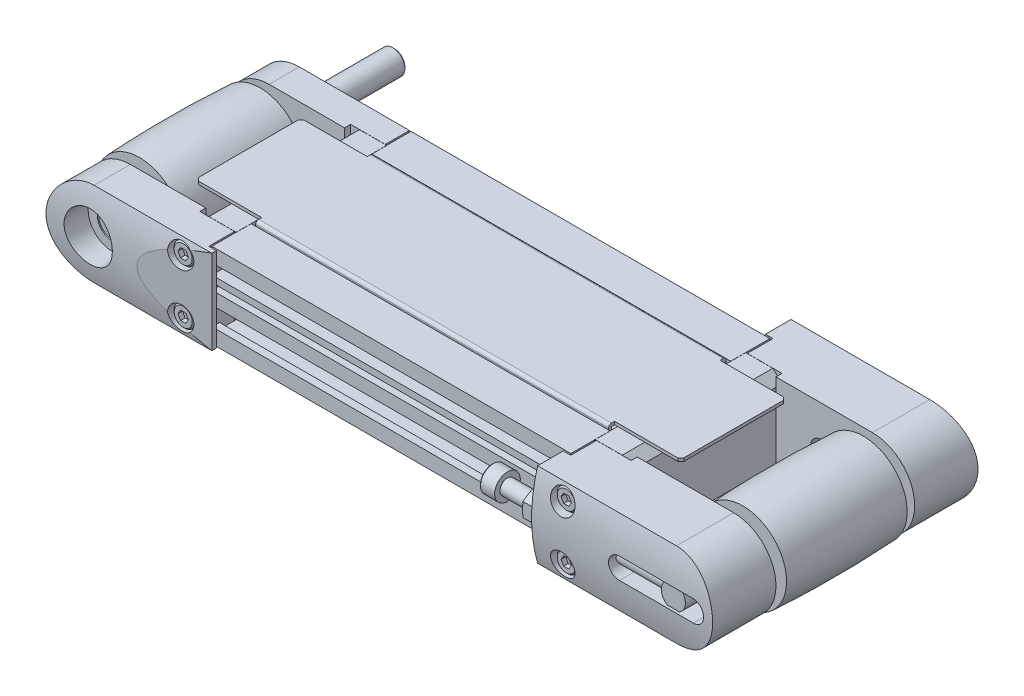
from build123d import *

# Parameters (mm, degrees)
EXTRUDE_1_DEPTH           = 14
EXTRUDE_1_DEPTH_BACK      = 14
EXTRUDE_2_DEPTH           = 14
EXTRUDE_2_DEPTH_BACK      = 14
CUT_EXTRUDE_1_DEPTH       = 10
CUT_EXTRUDE_START         = -14
CUT_EXTRUDE_2_DEPTH       = 14
CUT_EXTRUDE_3_DEPTH       = 55
EXTRUDE_3_DEPTH           = 25
EXTRUDE_3_DEPTH_BACK      = 25
EXTRUDE_4_DEPTH           = 1
EXTRUDE_4_DEPTH_BACK      = 1
SKETCH_10_W               = 3
SKETCH_10_H               = 28
SKETCH_11_W               = 0.05
SKETCH_11_H               = 0.05
CUT_EXTRUDE_4_DEPTH       = 9
SKETCH_12_W               = 0.05
SKETCH_12_H               = 0.05
CUT_EXTRUDE_5_DEPTH       = 9
SKETCH_13_W               = 0.05
SKETCH_13_H               = 0.05
CUT_EXTRUDE_6_DEPTH       = 9
SKETCH_14_W               = 0.05
SKETCH_14_H               = 0.05
CUT_EXTRUDE_7_DEPTH       = 9
SKETCH_15_R               = 2.5
EXTRUDE_5_DEPTH           = 119
SKETCH_16_R               = 2.5
EXTRUDE_6_DEPTH           = 119
SKETCH_17_W               = 5
SKETCH_17_H               = 0.05
CUT_EXTRUDE_8_DEPTH       = 0.05
SKETCH_18_W               = 5
SKETCH_18_H               = 0.05
CUT_EXTRUDE_9_DEPTH       = 0.05
SKETCH_19_W               = 5
SKETCH_19_H               = 0.05
CUT_EXTRUDE_10_DEPTH      = 0.05
SKETCH_20_W               = 5
SKETCH_20_H               = 0.05
CUT_EXTRUDE_11_DEPTH      = 0.05
SKETCH_21_W               = 6
SKETCH_21_H               = 4
SKETCH_22_W               = 6
SKETCH_22_H               = 4
CUT_EXTRUDE_12_DEPTH      = 1.5
CUT_EXTRUDE_13_DEPTH      = 1.5
EXTRUDE_7_DEPTH           = 1
EXTRUDE_7_DEPTH_BACK      = 1
SKETCH_27_W               = 3
SKETCH_27_H               = 28
EXTRUDE_8_DEPTH           = 25
EXTRUDE_8_DEPTH_BACK      = 25
SKETCH_29_W               = 5.05
SKETCH_29_H               = 0.05
CUT_EXTRUDE_14_DEPTH      = 0.05
SKETCH_30_W               = 5.05
SKETCH_30_H               = 0.05
CUT_EXTRUDE_15_DEPTH      = 0.05
SKETCH_31_W               = 5.05
SKETCH_31_H               = 0.05
CUT_EXTRUDE_16_DEPTH      = 0.05
SKETCH_32_W               = 5.05
SKETCH_32_H               = 0.05
CUT_EXTRUDE_17_DEPTH      = 0.05
EXTRUDE_9_DEPTH           = 14
EXTRUDE_9_DEPTH_BACK      = 14
SKETCH_34_W               = 0.05
SKETCH_34_H               = 0.05
CUT_EXTRUDE_18_DEPTH      = 9
SKETCH_35_W               = 0.05
SKETCH_35_H               = 0.05
CUT_EXTRUDE_19_DEPTH      = 9
EXTRUDE_10_DEPTH          = 14
EXTRUDE_10_DEPTH_BACK     = 14
SKETCH_37_W               = 0.05
SKETCH_37_H               = 0.05
CUT_EXTRUDE_20_DEPTH      = 9
SKETCH_38_W               = 0.05
SKETCH_38_H               = 0.05
CUT_EXTRUDE_21_DEPTH      = 9
CUT_EXTRUDE_22_DEPTH      = 118
CUT_EXTRUDE_23_DEPTH      = 60
CUT_EXTRUDE_24_DEPTH      = 60
SKETCH_42_W               = 5
SKETCH_42_H               = 4
SKETCH_43_W               = 5
SKETCH_43_H               = 4
CUT_EXTRUDE_25_DEPTH      = 1.5
CUT_EXTRUDE_26_DEPTH      = 1.5
SKETCH_48_W               = 5
SKETCH_48_H               = 4
SKETCH_49_W               = 5
SKETCH_49_H               = 4
CUT_EXTRUDE_27_DEPTH      = 1.5
CUT_EXTRUDE_28_DEPTH      = 1.5
EXTRUDE_11_DEPTH          = 117
EXTRUDE_12_DEPTH          = 1
EXTRUDE_13_DEPTH          = 1
CUT_EXTRUDE_29_DEPTH      = 59
CUT_EXTRUDE_29_DEPTH_BACK = 59
SKETCH_60_R               = 5.5
CUT_EXTRUDE_30_DEPTH      = 4
CUT_EXTRUDE_31_DEPTH      = 1.2
SKETCH_64_R               = 5.5
CUT_EXTRUDE_32_DEPTH      = 4
CUT_EXTRUDE_33_DEPTH      = 1.2


with BuildPart() as part:
    # 草图1 → 旋转1 (revolve)
    with BuildSketch(Plane(origin=(0, 0, 0), x_dir=(1, 0, 0), z_dir=(0, 1, 0))):
        with BuildLine():
            Line((0, -10), (5.75, -10))
            Line((5.75, -10), (5.75, -13))
            Line((5.75, -13), (14.5, -13))
            ThreePointArc((14.5, -13), (15, -33), (14.5, -53))
            Line((14.5, -53), (5.75, -53))
            Line((5.75, -53), (5.75, -56))
            Line((5.75, -56), (0, -56))
            Line((0, -56), (0, -10))
        make_face()
    revolve(axis=Axis((0, 0, 56), (0, 0, -1)))

    # 草图2 → 凸台-拉伸1 (add, two sides: drawn at the far end of the back side and taken through both)
    with BuildSketch(Plane(origin=(0, 0, 0), x_dir=(1, 0, 0), z_dir=(0, 1, 0)).offset(-EXTRUDE_1_DEPTH_BACK)):
        Polygon((-14, 0), (-14, -10), (25, -10), (25, -8), (36.5, -8), (36.5, 0), align=None)
    extrude(amount=EXTRUDE_1_DEPTH + EXTRUDE_1_DEPTH_BACK)

    # 草图3 → 凸台-拉伸2 (add, two sides: drawn at the far end of the back side and taken through both)
    with BuildSketch(Plane(origin=(0, 0, 0), x_dir=(1, 0, 0), z_dir=(0, 1, 0)).offset(-EXTRUDE_2_DEPTH_BACK)):
        Polygon((-14, -56), (-14, -70), (16.139895394, -70), (39, -68), (39, -66.5), (36.5, -66.5), (36.5, -58), (25, -58), (25, -56), align=None)
    extrude(amount=EXTRUDE_2_DEPTH + EXTRUDE_2_DEPTH_BACK)

    # 草图4 → 切除-拉伸1 (cut)
    with BuildSketch(Plane.XY):
        with BuildLine():
            Line((-28, -14), (0, -14))
            ThreePointArc((0, -14), (-14, 0), (0, 14))
            Line((0, 14), (-28, 14))
            Line((-28, 14), (-28, -14))
        make_face()
    extrude(amount=CUT_EXTRUDE_1_DEPTH, mode=Mode.SUBTRACT)

    # 草图5 → 切除-拉伸2 (cut)
    with BuildSketch(Plane.XY.offset(70).offset(CUT_EXTRUDE_START)):
        with BuildLine():
            Line((-28, -14), (0, -14))
            ThreePointArc((0, -14), (-14, 0), (0, 14))
            Line((0, 14), (-28, 14))
            Line((-28, 14), (-28, -14))
        make_face()
    extrude(amount=CUT_EXTRUDE_2_DEPTH, mode=Mode.SUBTRACT)

    # 草图6 → 切除-拉伸3 (cut)
    with BuildSketch(Plane(origin=(-15, 0, 0), x_dir=(0, 0, -1), z_dir=(1, 0, 0))):
        with BuildLine():
            Line((-85, 14), (-85, -14))
            Line((-85, -14), (-68, -14))
            ThreePointArc((-68, -14), (-70, 0), (-68, 14))
            Line((-68, 14), (-85, 14))
        make_face()
    extrude(amount=CUT_EXTRUDE_3_DEPTH, mode=Mode.SUBTRACT)

    # 草图7 → 切除-旋转1 (revolve, cut)
    with BuildSketch(Plane(origin=(0, 0, 0), x_dir=(1, 0, 0), z_dir=(0, 1, 0))):
        Polygon((0, -70), (-8, -70), (-8, -62), (-5, -62), (-5, -61.5), (-4.5, -62), (0, -62), align=None)
    revolve(axis=Axis((0, 0, 62), (0, 0, 1)), mode=Mode.SUBTRACT)

    # 草图8 → 旋转2 (revolve)
    with BuildSketch(Plane(origin=(0, 0, 0), x_dir=(1, 0, 0), z_dir=(0, 1, 0))):
        Polygon((0, 0), (-4, 0), (-4, 31), (-3.5, 31.5), (0, 31.5), align=None)
    revolve(axis=Axis((0, 0, -31.5), (0, 0, 1)))

    # 草图9 → 凸台-拉伸3 (add, two sides: drawn at the far end of the back side and taken through both)
    with BuildSketch(Plane.XY.offset(33).offset(-EXTRUDE_3_DEPTH_BACK)):
        Polygon((25, -11), (28, -14), (37, -14), (37, 14), (28, 14), (25, 11), align=None)
    extrude(amount=EXTRUDE_3_DEPTH + EXTRUDE_3_DEPTH_BACK)

    # 草图10 → 凸台-拉伸4 (add, two sides: drawn at the far end of the back side and taken through both)
    with BuildSketch(Plane.XY.offset(33).offset(-EXTRUDE_4_DEPTH_BACK)):
        with Locations((38.5, 0)):
            Rectangle(SKETCH_10_W, SKETCH_10_H)
    extrude(amount=EXTRUDE_4_DEPTH + EXTRUDE_4_DEPTH_BACK)

    # 草图11 → 切除-拉伸4 (cut)
    with BuildSketch(Plane(origin=(28, 0, 0), x_dir=(0, 0, -1), z_dir=(1, 0, 0))):
        with Locations((-8.025, 13.975)):
            Rectangle(SKETCH_11_W, SKETCH_11_H)
    extrude(amount=CUT_EXTRUDE_4_DEPTH, mode=Mode.SUBTRACT)

    # 草图12 → 切除-拉伸5 (cut)
    with BuildSketch(Plane(origin=(28, 0, 0), x_dir=(0, 0, -1), z_dir=(1, 0, 0))):
        with Locations((-8.025, -13.975)):
            Rectangle(SKETCH_12_W, SKETCH_12_H)
    extrude(amount=CUT_EXTRUDE_5_DEPTH, mode=Mode.SUBTRACT)

    # 草图13 → 切除-拉伸6 (cut)
    with BuildSketch(Plane(origin=(28, 0, 0), x_dir=(0, 0, -1), z_dir=(1, 0, 0))):
        with Locations((-57.975, 13.975)):
            Rectangle(SKETCH_13_W, SKETCH_13_H)
    extrude(amount=CUT_EXTRUDE_6_DEPTH, mode=Mode.SUBTRACT)

    # 草图14 → 切除-拉伸7 (cut)
    with BuildSketch(Plane(origin=(28, 0, 0), x_dir=(0, 0, -1), z_dir=(1, 0, 0))):
        with Locations((-57.975, -13.975)):
            Rectangle(SKETCH_14_W, SKETCH_14_H)
    extrude(amount=CUT_EXTRUDE_7_DEPTH, mode=Mode.SUBTRACT)

    # 草图15 → 凸台-拉伸5 (add)
    with BuildSketch(Plane(origin=(37, 0, 0), x_dir=(0, 0, -1), z_dir=(1, 0, 0))):
        Polygon((-66, 14), (-66, 9.25), (-62, 9.25), (-62, 10.35), (-59, 10.35), (-59, 9.25), (-57.8, 9.25), (-57.8, 5.75), (-59, 5.75), (-59, 4.65), (-62, 4.65), (-62, 5.75), (-66, 5.75), (-66, 3.6), (-63, 3.6), (-63, 1.4), (-66, 1.4), (-66, -2.9), (-63.5, -2.9), (-63.5, -0.9), (-57.5, -0.9), (-57.5, -2.9), (-56, -2.9), (-56, -9.1), (-57.5, -9.1), (-57.5, -11.1), (-63.5, -11.1), (-63.5, -9.1), (-66, -9.1), (-66, -14), (-53, -14), (-53, -5), (-48.5, -5), (-48.5, -8), (-34, -8), (-34, -4), (-35.5, -4), (-35.5, -5), (-41.5, -5), (-41.5, -4), (-42.5, -4), (-42.5, 4), (-41.5, 4), (-41.5, 5), (-35.5, 5), (-35.5, 4), (-34, 4), (-34, 8), (-48.5, 8), (-48.5, 5), (-53, 5), (-53, 14), align=None)
        with Locations((-50, 0)):
            Circle(SKETCH_15_R, mode=Mode.SUBTRACT)
    extrude(amount=EXTRUDE_5_DEPTH)

    # 草图16 → 凸台-拉伸6 (add)
    with BuildSketch(Plane(origin=(37, 0, 0), x_dir=(0, 0, -1), z_dir=(1, 0, 0))):
        Polygon((-32, 8), (-32, 4), (-30.5, 4), (-30.5, 5), (-24.5, 5), (-24.5, 4), (-23.5, 4), (-23.5, -4), (-24.5, -4), (-24.5, -5), (-30.5, -5), (-30.5, -4), (-32, -4), (-32, -8), (-17.5, -8), (-17.5, -5), (-13, -5), (-13, -14), (0, -14), (0, -9.1), (-2.5, -9.1), (-2.5, -11.1), (-8.5, -11.1), (-8.5, -9.1), (-10, -9.1), (-10, -2.9), (-8.5, -2.9), (-8.5, -0.9), (-2.5, -0.9), (-2.5, -2.9), (0, -2.9), (0, 1.4), (-3, 1.4), (-3, 3.6), (0, 3.6), (0, 5.75), (-4, 5.75), (-4, 4.65), (-7, 4.65), (-7, 5.75), (-8.2, 5.75), (-8.2, 9.25), (-7, 9.25), (-7, 10.35), (-4, 10.35), (-4, 9.25), (0, 9.25), (0, 14), (-13, 14), (-13, 5), (-17.5, 5), (-17.5, 8), align=None)
        with Locations((-16, 0)):
            Circle(SKETCH_16_R, mode=Mode.SUBTRACT)
    extrude(amount=EXTRUDE_6_DEPTH)

    # 草图17 → 切除-拉伸8 (cut)
    with BuildSketch(Plane(origin=(37, 0, 0), x_dir=(0, 0, -1), z_dir=(1, 0, 0))):
        with Locations((-10.5, 13.975)):
            Rectangle(SKETCH_17_W, SKETCH_17_H)
    extrude(amount=CUT_EXTRUDE_8_DEPTH, mode=Mode.SUBTRACT)

    # 草图18 → 切除-拉伸9 (cut)
    with BuildSketch(Plane(origin=(37, 0, 0), x_dir=(0, 0, -1), z_dir=(1, 0, 0))):
        with Locations((-55.5, 13.975)):
            Rectangle(SKETCH_18_W, SKETCH_18_H)
    extrude(amount=CUT_EXTRUDE_9_DEPTH, mode=Mode.SUBTRACT)

    # 草图19 → 切除-拉伸10 (cut)
    with BuildSketch(Plane(origin=(37, 0, 0), x_dir=(0, 0, -1), z_dir=(1, 0, 0))):
        with Locations((-10.5, -13.975)):
            Rectangle(SKETCH_19_W, SKETCH_19_H)
    extrude(amount=CUT_EXTRUDE_10_DEPTH, mode=Mode.SUBTRACT)

    # 草图20 → 切除-拉伸11 (cut)
    with BuildSketch(Plane(origin=(37, 0, 0), x_dir=(0, 0, -1), z_dir=(1, 0, 0))):
        with Locations((-55.5, -13.975)):
            Rectangle(SKETCH_20_W, SKETCH_20_H)
    extrude(amount=CUT_EXTRUDE_11_DEPTH, mode=Mode.SUBTRACT)

    # 草图21 → 切除-旋转2 (revolve, cut)
    with BuildSketch(Plane(origin=(29.5, 0, 0), x_dir=(0, 0, -1), z_dir=(1, 0, 0))):
        with Locations((-67, 11)):
            Rectangle(SKETCH_21_W, SKETCH_21_H)
    revolve(axis=Axis((29.5, 9, 64), (0, 0, 1)), mode=Mode.SUBTRACT)

    # 草图22 → 切除-旋转3 (revolve, cut)
    with BuildSketch(Plane(origin=(29.5, 0, 0), x_dir=(0, 0, -1), z_dir=(1, 0, 0))):
        with Locations((-67, -7)):
            Rectangle(SKETCH_22_W, SKETCH_22_H)
    revolve(axis=Axis((29.5, -9, 64), (0, 0, 1)), mode=Mode.SUBTRACT)

    # 草图23 → 旋转3 (revolve)
    with BuildSketch(Plane(origin=(29.5, 0, 0), x_dir=(0, 0, -1), z_dir=(1, 0, 0))):
        Polygon((-68, 9), (-68, 12), (-67.5, 12.5), (-62, 12.5), (-62, 9), align=None)
    revolve(axis=Axis((29.5, 9, 62), (0, 0, 1)))

    # 草图24 → 切除-拉伸12 (cut)
    with BuildSketch(Plane.XY.offset(68)):
        Polygon((28.633974596, 7.5), (30.366025404, 7.5), (31.232050808, 9), (30.366025404, 10.5), (28.633974596, 10.5), (27.767949192, 9), align=None)
    extrude(amount=-CUT_EXTRUDE_12_DEPTH, mode=Mode.SUBTRACT)

    # 草图25 → 旋转4 (revolve)
    with BuildSketch(Plane(origin=(29.5, 0, 0), x_dir=(0, 0, -1), z_dir=(1, 0, 0))):
        Polygon((-68, -9), (-68, -6), (-67.5, -5.5), (-62, -5.5), (-62, -9), align=None)
    revolve(axis=Axis((29.5, -9, 62), (0, 0, 1)))

    # 草图26 → 切除-拉伸13 (cut)
    with BuildSketch(Plane.XY.offset(68)):
        Polygon((28.633974596, -10.5), (30.366025404, -10.5), (31.232050808, -9), (30.366025404, -7.5), (28.633974596, -7.5), (27.767949192, -9), align=None)
    extrude(amount=-CUT_EXTRUDE_13_DEPTH, mode=Mode.SUBTRACT)

    # 草图27 → 凸台-拉伸7 (add, two sides: drawn at the far end of the back side and taken through both)
    with BuildSketch(Plane.XY.offset(33).offset(-EXTRUDE_7_DEPTH_BACK)):
        with Locations((154.5, 0)):
            Rectangle(SKETCH_27_W, SKETCH_27_H)
    extrude(amount=EXTRUDE_7_DEPTH + EXTRUDE_7_DEPTH_BACK)

    # 草图28 → 凸台-拉伸8 (add, two sides: drawn at the far end of the back side and taken through both)
    with BuildSketch(Plane.XY.offset(33).offset(-EXTRUDE_8_DEPTH_BACK)):
        Polygon((156, -14), (165, -14), (168, -11), (168, 11), (165, 14), (156, 14), align=None)
    extrude(amount=EXTRUDE_8_DEPTH + EXTRUDE_8_DEPTH_BACK)

    # 草图29 → 切除-拉伸14 (cut)
    with BuildSketch(Plane(origin=(156, 0, 0), x_dir=(0, 0, -1), z_dir=(1, 0, 0))):
        with Locations((-10.525, 13.975)):
            Rectangle(SKETCH_29_W, SKETCH_29_H)
    extrude(amount=CUT_EXTRUDE_14_DEPTH, mode=Mode.SUBTRACT)

    # 草图30 → 切除-拉伸15 (cut)
    with BuildSketch(Plane(origin=(156, 0, 0), x_dir=(0, 0, -1), z_dir=(1, 0, 0))):
        with Locations((-55.475, 13.975)):
            Rectangle(SKETCH_30_W, SKETCH_30_H)
    extrude(amount=CUT_EXTRUDE_15_DEPTH, mode=Mode.SUBTRACT)

    # 草图31 → 切除-拉伸16 (cut)
    with BuildSketch(Plane(origin=(156, 0, 0), x_dir=(0, 0, -1), z_dir=(1, 0, 0))):
        with Locations((-10.525, -13.975)):
            Rectangle(SKETCH_31_W, SKETCH_31_H)
    extrude(amount=CUT_EXTRUDE_16_DEPTH, mode=Mode.SUBTRACT)

    # 草图32 → 切除-拉伸17 (cut)
    with BuildSketch(Plane(origin=(156, 0, 0), x_dir=(0, 0, -1), z_dir=(1, 0, 0))):
        with Locations((-55.475, -13.975)):
            Rectangle(SKETCH_32_W, SKETCH_32_H)
    extrude(amount=CUT_EXTRUDE_17_DEPTH, mode=Mode.SUBTRACT)

    # 草图33 → 凸台-拉伸9 (add, two sides: drawn at the far end of the back side and taken through both)
    with BuildSketch(Plane(origin=(0, 0, 0), x_dir=(1, 0, 0), z_dir=(0, 1, 0)).offset(-EXTRUDE_9_DEPTH_BACK)):
        Polygon((154, 0.5), (156.5, 0.5), (156.5, -8), (168, -8), (168, -10), (214, -10), (214, 11), (154, 11), align=None)
    extrude(amount=EXTRUDE_9_DEPTH + EXTRUDE_9_DEPTH_BACK)

    # 草图34 → 切除-拉伸18 (cut)
    with BuildSketch(Plane(origin=(156, 0, 0), x_dir=(0, 0, -1), z_dir=(1, 0, 0))):
        with Locations((-8.025, 13.975)):
            Rectangle(SKETCH_34_W, SKETCH_34_H)
    extrude(amount=CUT_EXTRUDE_18_DEPTH, mode=Mode.SUBTRACT)

    # 草图35 → 切除-拉伸19 (cut)
    with BuildSketch(Plane(origin=(156, 0, 0), x_dir=(0, 0, -1), z_dir=(1, 0, 0))):
        with Locations((-8.025, -13.975)):
            Rectangle(SKETCH_35_W, SKETCH_35_H)
    extrude(amount=CUT_EXTRUDE_19_DEPTH, mode=Mode.SUBTRACT)

    # 草图36 → 凸台-拉伸10 (add, two sides: drawn at the far end of the back side and taken through both)
    with BuildSketch(Plane(origin=(0, 0, 0), x_dir=(1, 0, 0), z_dir=(0, 1, 0)).offset(-EXTRUDE_10_DEPTH_BACK)):
        Polygon((154, -66.5), (154, -77), (214, -77), (214, -56), (168, -56), (168, -58), (156.5, -58), (156.5, -66.5), align=None)
    extrude(amount=EXTRUDE_10_DEPTH + EXTRUDE_10_DEPTH_BACK)

    # 草图37 → 切除-拉伸20 (cut)
    with BuildSketch(Plane(origin=(156, 0, 0), x_dir=(0, 0, -1), z_dir=(1, 0, 0))):
        with Locations((-57.975, 13.975)):
            Rectangle(SKETCH_37_W, SKETCH_37_H)
    extrude(amount=CUT_EXTRUDE_20_DEPTH, mode=Mode.SUBTRACT)

    # 草图38 → 切除-拉伸21 (cut)
    with BuildSketch(Plane(origin=(156, 0, 0), x_dir=(0, 0, -1), z_dir=(1, 0, 0))):
        with Locations((-57.975, -13.975)):
            Rectangle(SKETCH_38_W, SKETCH_38_H)
    extrude(amount=CUT_EXTRUDE_21_DEPTH, mode=Mode.SUBTRACT)

    # 草图39 → 切除-拉伸22 (cut)
    with BuildSketch(Plane.XY.offset(-30)):
        with BuildLine():
            Line((200, -14), (228, -14))
            Line((228, -14), (228, 14))
            Line((228, 14), (200, 14))
            ThreePointArc((200, 14), (214, 0), (200, -14))
        make_face()
    extrude(amount=CUT_EXTRUDE_22_DEPTH, mode=Mode.SUBTRACT)

    # 草图40 → 切除-拉伸23 (cut)
    with BuildSketch(Plane(origin=(214, 0, 0), x_dir=(0, 0, -1), z_dir=(1, 0, 0))):
        with BuildLine():
            Line((9, -14), (21, -14))
            Line((21, -14), (21, 14))
            Line((21, 14), (9, 14))
            ThreePointArc((9, 14), (11, 0), (9, -14))
        make_face()
    extrude(amount=-CUT_EXTRUDE_23_DEPTH, mode=Mode.SUBTRACT)

    # 草图41 → 切除-拉伸24 (cut)
    with BuildSketch(Plane(origin=(214, 0, 0), x_dir=(0, 0, -1), z_dir=(1, 0, 0))):
        with BuildLine():
            Line((-87, 14), (-87, -14))
            Line((-87, -14), (-75, -14))
            ThreePointArc((-75, -14), (-77, 0), (-75, 14))
            Line((-75, 14), (-87, 14))
        make_face()
    extrude(amount=-CUT_EXTRUDE_24_DEPTH, mode=Mode.SUBTRACT)

    # 草图42 → 切除-旋转4 (revolve, cut)
    with BuildSketch(Plane(origin=(163.5, 0, 0), x_dir=(0, 0, -1), z_dir=(1, 0, 0))):
        with Locations((8.5, 11)):
            Rectangle(SKETCH_42_W, SKETCH_42_H)
    revolve(axis=Axis((163.5, 9, -11), (0, 0, 1)), mode=Mode.SUBTRACT)

    # 草图43 → 切除-旋转5 (revolve, cut)
    with BuildSketch(Plane(origin=(163.5, 0, 0), x_dir=(0, 0, -1), z_dir=(1, 0, 0))):
        with Locations((8.5, -7)):
            Rectangle(SKETCH_43_W, SKETCH_43_H)
    revolve(axis=Axis((163.5, -9, -11), (0, 0, 1)), mode=Mode.SUBTRACT)

    # 草图44 → 旋转5 (revolve)
    with BuildSketch(Plane(origin=(163.5, 0, 0), x_dir=(0, 0, -1), z_dir=(1, 0, 0))):
        Polygon((4, 9), (4, 12.5), (8.5, 12.5), (9, 12), (9, 9), align=None)
    revolve(axis=Axis((163.5, 9, -9), (0, 0, 1)))

    # 草图45 → 旋转6 (revolve)
    with BuildSketch(Plane(origin=(163.5, 0, 0), x_dir=(0, 0, -1), z_dir=(1, 0, 0))):
        Polygon((4, -9), (4, -5.5), (8.5, -5.5), (9, -6), (9, -9), align=None)
    revolve(axis=Axis((163.5, -9, -9), (0, 0, 1)))

    # 草图46 → 切除-拉伸25 (cut)
    with BuildSketch(Plane(origin=(0, 0, -9), x_dir=(-1, 0, 0), z_dir=(0, 0, -1))):
        Polygon((-164.366025404, 7.5), (-162.633974596, 7.5), (-161.767949192, 9), (-162.633974596, 10.5), (-164.366025404, 10.5), (-165.232050808, 9), align=None)
    extrude(amount=-CUT_EXTRUDE_25_DEPTH, mode=Mode.SUBTRACT)

    # 草图47 → 切除-拉伸26 (cut)
    with BuildSketch(Plane(origin=(0, 0, -9), x_dir=(-1, 0, 0), z_dir=(0, 0, -1))):
        Polygon((-164.366025404, -10.5), (-162.633974596, -10.5), (-161.767949192, -9), (-162.633974596, -7.5), (-164.366025404, -7.5), (-165.232050808, -9), align=None)
    extrude(amount=-CUT_EXTRUDE_26_DEPTH, mode=Mode.SUBTRACT)

    # 草图48 → 切除-旋转6 (revolve, cut)
    with BuildSketch(Plane(origin=(163.5, 0, 0), x_dir=(0, 0, -1), z_dir=(1, 0, 0))):
        with Locations((-74.5, 11)):
            Rectangle(SKETCH_48_W, SKETCH_48_H)
    revolve(axis=Axis((163.5, 9, 72), (0, 0, 1)), mode=Mode.SUBTRACT)

    # 草图49 → 切除-旋转7 (revolve, cut)
    with BuildSketch(Plane(origin=(163.5, 0, 0), x_dir=(0, 0, -1), z_dir=(1, 0, 0))):
        with Locations((-74.5, -7)):
            Rectangle(SKETCH_49_W, SKETCH_49_H)
    revolve(axis=Axis((163.5, -9, 72), (0, 0, 1)), mode=Mode.SUBTRACT)

    # 草图50 → 旋转7 (revolve)
    with BuildSketch(Plane(origin=(163.5, 0, 0), x_dir=(0, 0, -1), z_dir=(1, 0, 0))):
        Polygon((-75, 9), (-75, 12), (-74.5, 12.5), (-70, 12.5), (-70, 9), align=None)
    revolve(axis=Axis((163.5, 9, 70), (0, 0, 1)))

    # 草图51 → 旋转8 (revolve)
    with BuildSketch(Plane(origin=(163.5, 0, 0), x_dir=(0, 0, -1), z_dir=(1, 0, 0))):
        Polygon((-75, -9), (-75, -6), (-74.5, -5.5), (-70, -5.5), (-70, -9), align=None)
    revolve(axis=Axis((163.5, -9, 70), (0, 0, 1)))

    # 草图52 → 切除-拉伸27 (cut)
    with BuildSketch(Plane.XY.offset(75)):
        Polygon((162.633974596, 7.5), (164.366025404, 7.5), (165.232050808, 9), (164.366025404, 10.5), (162.633974596, 10.5), (161.767949192, 9), align=None)
    extrude(amount=-CUT_EXTRUDE_27_DEPTH, mode=Mode.SUBTRACT)

    # 草图53 → 切除-拉伸28 (cut)
    with BuildSketch(Plane.XY.offset(75)):
        Polygon((162.633974596, -10.5), (164.366025404, -10.5), (165.232050808, -9), (164.366025404, -7.5), (162.633974596, -7.5), (161.767949192, -9), align=None)
    extrude(amount=-CUT_EXTRUDE_28_DEPTH, mode=Mode.SUBTRACT)

    # 草图54 → 凸台-拉伸11 (add)
    with BuildSketch(Plane(origin=(38, 0, 0), x_dir=(0, 0, -1), z_dir=(1, 0, 0))):
        with BuildLine():
            Line((-52.5, 5), (-51.5, 5))
            Line((-51.5, 5), (-51.5, 14))
            Line((-51.5, 14), (-14.5, 14))
            Line((-14.5, 14), (-14.5, 5))
            Line((-14.5, 5), (-13.5, 5))
            Line((-13.5, 5), (-13.5, 14))
            ThreePointArc((-13.5, 14), (-13.792893219, 14.707106781), (-14.5, 15))
            Line((-14.5, 15), (-51.5, 15))
            ThreePointArc((-51.5, 15), (-52.207106781, 14.707106781), (-52.5, 14))
            Line((-52.5, 14), (-52.5, 5))
        make_face()
    extrude(amount=EXTRUDE_11_DEPTH)

    # 草图55 → 凸台-拉伸12 (add)
    with BuildSketch(Plane(origin=(0, 14, 0), x_dir=(1, 0, 0), z_dir=(0, 1, 0))):
        Polygon((16.038, -49.5), (17.038, -50.5), (38, -50.5), (38, -15.5), (17.038, -15.5), (16.038, -16.5), align=None)
    extrude(amount=EXTRUDE_12_DEPTH)

    # 草图56 → 凸台-拉伸13 (add)
    with BuildSketch(Plane(origin=(0, 14, 0), x_dir=(1, 0, 0), z_dir=(0, 1, 0))):
        Polygon((155, -50.5), (175.962, -50.5), (176.962, -49.5), (176.962, -16.5), (175.962, -15.5), (155, -15.5), align=None)
    extrude(amount=EXTRUDE_13_DEPTH)

    # 草图57 → 切除-拉伸29 (cut, two sides: drawn at the far end of the back side and taken through both)
    with BuildSketch(Plane.XY.offset(33).offset(-CUT_EXTRUDE_29_DEPTH_BACK)):
        with BuildLine():
            Line((183, -3.5), (207.5, -3.5))
            ThreePointArc((207.5, -3.5), (211, 0), (207.5, 3.5))
            Line((207.5, 3.5), (183, 3.5))
            ThreePointArc((183, 3.5), (179.5, 0), (183, -3.5))
        make_face()
    extrude(amount=CUT_EXTRUDE_29_DEPTH + CUT_EXTRUDE_29_DEPTH_BACK, mode=Mode.SUBTRACT)

    # 草图58 → 旋转9 (revolve)
    with BuildSketch(Plane(origin=(0, 0, 0), x_dir=(1, 0, 0), z_dir=(0, 1, 0))):
        with BuildLine():
            Line((200, 10), (204, 10))
            Line((204, 10), (204, -10.35))
            Line((204, -10.35), (206, -10.35))
            Line((206, -10.35), (206, -11.85))
            Line((206, -11.85), (205.75, -11.85))
            Line((205.75, -11.85), (205.75, -12))
            Line((205.75, -12), (207.65, -12))
            Line((207.65, -12), (207.65, -13))
            Line((207.65, -13), (214.5, -13))
            ThreePointArc((214.5, -13), (215, -33), (214.5, -53))
            Line((214.5, -53), (207.65, -53))
            Line((207.65, -53), (207.65, -54))
            Line((207.65, -54), (205.75, -54))
            Line((205.75, -54), (205.75, -54.15))
            Line((205.75, -54.15), (206, -54.15))
            Line((206, -54.15), (206, -55.65))
            Line((206, -55.65), (204, -55.65))
            Line((204, -55.65), (204, -76))
            Line((204, -76), (200, -76))
            Line((200, -76), (200, 10))
        make_face()
    revolve(axis=Axis((200, 0, 76), (0, 0, -1)))

    # 草图59 → 旋转10 (revolve)
    with BuildSketch(Plane(origin=(0, 0, 0), x_dir=(1, 0, 0), z_dir=(0, 1, 0))):
        Polygon((150, -69.5), (150.433, -69.933), (153.567, -69.933), (154, -69.5), (154, -67.2), (150.214359354, -67.2), (150, -68), align=None)
    revolve(axis=Axis((154, 0, 72), (-1, 0, 0)))

    # 草图60 → 切除-拉伸30 (cut)
    with BuildSketch(Plane.ZY.offset(-150)):
        with Locations((72, 0)):
            Circle(SKETCH_60_R)
        Polygon((76, -2.309401077), (76, 2.309401077), (72, 4.618802154), (68, 2.309401077), (68, -2.309401077), (72, -4.618802154), align=None, mode=Mode.SUBTRACT)
    extrude(amount=-CUT_EXTRUDE_30_DEPTH, mode=Mode.SUBTRACT)

    # 草图61 → 旋转11 (revolve)
    with BuildSketch(Plane(origin=(0, 0, 0), x_dir=(1, 0, 0), z_dir=(0, 1, 0))):
        Polygon((136, -72), (136, -68), (136.3, -67.75), (141, -67.75), (141, -69.5), (195.4595, -69.5), (195.95, -69.9905), (195.95, -72), align=None)
    revolve(axis=Axis((195.95, 0, 72), (-1, 0, 0)))

    # 草图62 → 切除-拉伸31 (cut)
    with BuildSketch(Plane.ZY.offset(-136)):
        Polygon((73.5, -0.866025404), (73.5, 0.866025404), (72, 1.732050808), (70.5, 0.866025404), (70.5, -0.866025404), (72, -1.732050808), align=None)
    extrude(amount=-CUT_EXTRUDE_31_DEPTH, mode=Mode.SUBTRACT)

    # 草图63 → 旋转12 (revolve)
    with BuildSketch(Plane(origin=(0, 0, 0), x_dir=(1, 0, 0), z_dir=(0, 1, 0))):
        Polygon((150, 8.5), (150.433, 8.067), (153.567, 8.067), (154, 8.5), (154, 10.8), (150.214359354, 10.8), (150, 10), align=None)
    revolve(axis=Axis((154, 0, -6), (-1, 0, 0)))

    # 草图64 → 切除-拉伸32 (cut)
    with BuildSketch(Plane.ZY.offset(-150)):
        with Locations((-6, 0)):
            Circle(SKETCH_64_R)
        Polygon((-2, -2.309401077), (-2, 2.309401077), (-6, 4.618802154), (-10, 2.309401077), (-10, -2.309401077), (-6, -4.618802154), align=None, mode=Mode.SUBTRACT)
    extrude(amount=-CUT_EXTRUDE_32_DEPTH, mode=Mode.SUBTRACT)

    # 草图65 → 旋转13 (revolve)
    with BuildSketch(Plane(origin=(0, 0, 0), x_dir=(1, 0, 0), z_dir=(0, 1, 0))):
        Polygon((136, 6), (136, 10), (136.3, 10.25), (141, 10.25), (141, 8.5), (195.4595, 8.5), (195.95, 8.0095), (195.95, 6), align=None)
    revolve(axis=Axis((195.95, 0, -6), (-1, 0, 0)))

    # 草图66 → 切除-拉伸33 (cut)
    with BuildSketch(Plane.ZY.offset(-136)):
        Polygon((-4.5, -0.866025404), (-4.5, 0.866025404), (-6, 1.732050808), (-7.5, 0.866025404), (-7.5, -0.866025404), (-6, -1.732050808), align=None)
    extrude(amount=-CUT_EXTRUDE_33_DEPTH, mode=Mode.SUBTRACT)


solid = part.part
